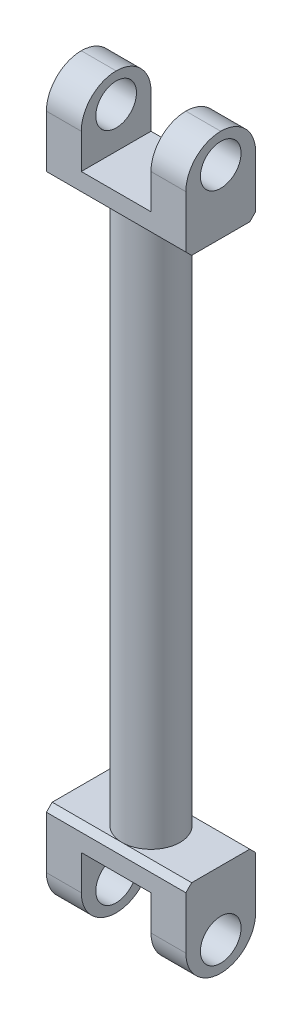
from build123d import *

# Parameters (mm, degrees)
SKETCH1_R                = 2.5
BOSS_EXTRUDE1_DEPTH      = 23.375
SKETCH2_W                = 12
SKETCH2_H                = 6
BOSS_EXTRUDE2_DEPTH      = 2
SKETCH3_W                = 3
SKETCH3_H                = 6
BOSS_EXTRUDE3_DEPTH      = 6
SKETCH4_R                = 1.75
CUT_EXTRUDE1_DEPTH       = 34.725222386
FILLET1_R                = 3
CHAMFER2_SIZE            = 0.5
FILLET1_OF_MIRROR1_R     = 3
CHAMFER2_OF_MIRROR1_SIZE = 0.5


with BuildPart() as part:
    # Sketch1 → Boss-Extrude1 (new, symmetric)
    with BuildSketch(Plane(origin=(0, 0, 0), x_dir=(1, 0, 0), z_dir=(0, 1, 0))):
        with Locations(Location((0, 0, 0), (0, 0, 270))):
            Circle(SKETCH1_R)
    extrude(amount=BOSS_EXTRUDE1_DEPTH, both=True)

    # Sketch2 → Boss-Extrude2 (add)
    with BuildSketch(Plane(origin=(0, 23.375, 0), x_dir=(1, 0, 0), z_dir=(0, 1, 0))):
        Rectangle(SKETCH2_W, SKETCH2_H)
    boss_extrude2 = extrude(amount=BOSS_EXTRUDE2_DEPTH)

    # Sketch3 → Boss-Extrude3 (add)
    with BuildSketch(Plane(origin=(0, 25.375, 0), x_dir=(1, 0, 0), z_dir=(0, 1, 0))):
        with Locations((-4.5, 0)):
            Rectangle(SKETCH3_W, SKETCH3_H)
        with Locations((4.5, 0)):
            Rectangle(SKETCH3_W, SKETCH3_H)
    boss_extrude3 = extrude(amount=BOSS_EXTRUDE3_DEPTH)

    # Sketch4 → Cut-Extrude1 (cut, through all)
    with BuildSketch(Plane.ZY.offset(6)):
        with Locations((0, 28.875)):
            Circle(SKETCH4_R)
    cut_extrude1 = extrude(amount=-CUT_EXTRUDE1_DEPTH, mode=Mode.SUBTRACT)

    # Fillet1
    fillet1_edges = [part.edges().sort_by_distance(p)[0] for p in [
        (4.5, 31.375, 3),
        (4.5, 31.375, -3),
        (-4.5, 31.375, 3),
        (-4.5, 31.375, -3),
    ]]
    fillet(fillet1_edges, radius=FILLET1_R - 0.0001)  # a hair under: the kernel refuses the full size

    # Chamfer2
    chamfer2_edges = [part.edges().sort_by_distance(p)[0] for p in [
        (0, 23.375, -3),
        (0, 23.375, 3),
    ]]
    chamfer(chamfer2_edges, length=CHAMFER2_SIZE - 0.0001)  # a hair under: the kernel refuses the full size

    # Mirror1: Boss-Extrude2, Boss-Extrude3, Cut-Extrude1 across plane
    add(boss_extrude2.mirror(Plane.ZX))
    add(boss_extrude3.mirror(Plane.ZX))
    add(cut_extrude1.mirror(Plane.ZX), mode=Mode.SUBTRACT)

    # Fillet1 of Mirror1
    fillet1_of_mirror1_edges = [part.edges().sort_by_distance(p)[0] for p in [
        (4.5, -31.375, 3),
        (4.5, -31.375, -3),
        (-4.5, -31.375, 3),
        (-4.5, -31.375, -3),
    ]]
    fillet(fillet1_of_mirror1_edges, radius=FILLET1_OF_MIRROR1_R - 0.0001)  # a hair under: the kernel refuses the full size

    # Chamfer2 of Mirror1
    chamfer2_of_mirror1_edges = [part.edges().sort_by_distance(p)[0] for p in [
        (0, -23.375, -3),
        (0, -23.375, 3),
    ]]
    chamfer(chamfer2_of_mirror1_edges, length=CHAMFER2_OF_MIRROR1_SIZE - 0.0001)  # a hair under: the kernel refuses the full size


solid = part.part
